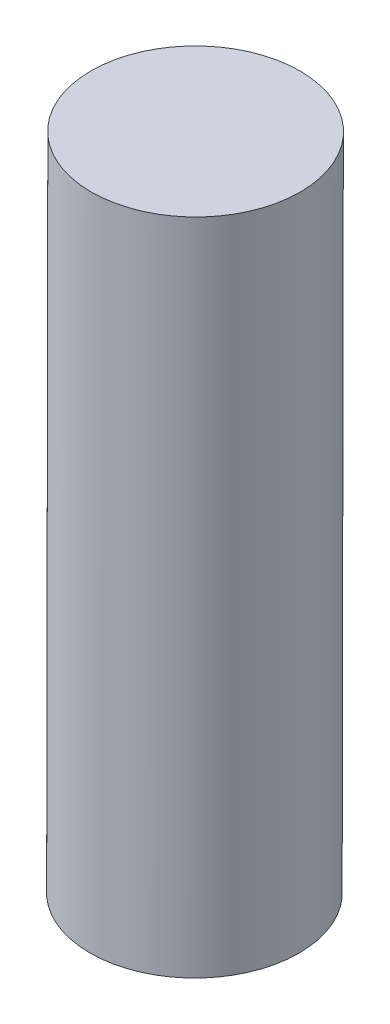
from build123d import *

# Parameters (mm, degrees)
SWEEP1_PROFILE_R = 4.699


with BuildPart() as part:
    # Sweep1: sweep along a curve in space
    with BuildLine() as sweep1_path:
        Line((-266.617064338, 133.219904817, 163.321796793), (-266.564789385, 162.850522994, 163.321797194))
    # Sweep1 profile (on start of the path) → Sweep1 (sweep)
    with BuildSketch(Plane(origin=(-266.617064338, 133.219904817, 163.321796793), x_dir=(0.9999984437661262, -0.0017642180493470062, 0), z_dir=(0.0017642180493470062, 0.9999984437661261, 1.3539260706781007e-08))):
        Circle(SWEEP1_PROFILE_R)
    sweep(path=sweep1_path.line)


solid = part.part
